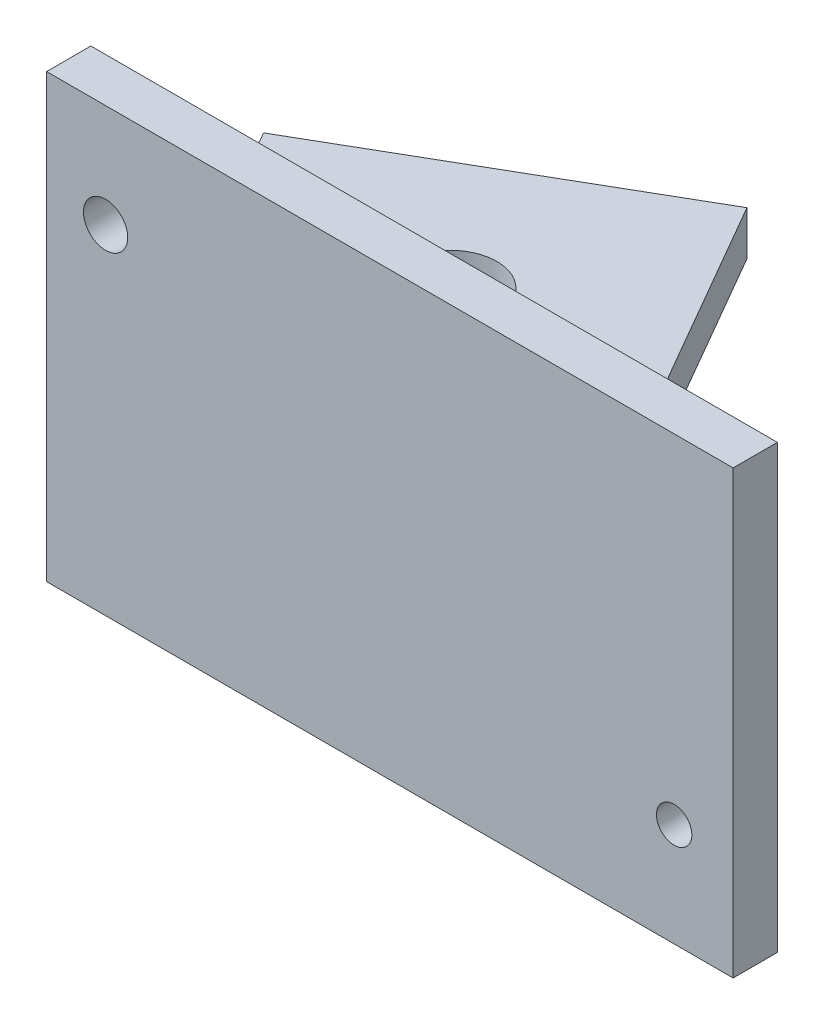
from build123d import *

# Parameters (mm, degrees)
SKETCH1_W           = 36.957
SKETCH1_H           = 21.3995
SKETCH1_R           = 1.190625
SKETCH1_R_2         = 0.9525
BOSS_EXTRUDE1_DEPTH = 2.38125
BOSS_EXTRUDE3_DEPTH = 2.38125
CUT_EXTRUDE2_REACH  = 53.986
SKETCH4_R           = 2.4892


with BuildPart() as part:
    # Sketch1 → Boss-Extrude1 (new body)
    with BuildSketch(Plane.XY):
        with Locations((16.891, 9.11225)):
            Rectangle(SKETCH1_W, SKETCH1_H)
        with Locations((1.5875, 14.25575)):
            Circle(SKETCH1_R, mode=Mode.SUBTRACT)
        with Locations((32.1945, 1.5875)):
            Circle(SKETCH1_R_2, mode=Mode.SUBTRACT)
    extrude(amount=BOSS_EXTRUDE1_DEPTH)

    # Sketch2 → Boss-Extrude3 (add)
    with BuildSketch(Plane.XZ.offset(1.5875)):
        Polygon((-1.5875, 2.38125), (35.3695, 2.38125), (35.3695, 0), (20.409545256, 0), (2.210283942, -31.522045256), (-14.2875, -21.997045256), (-1.5875, 0), align=None)
    extrude(amount=BOSS_EXTRUDE3_DEPTH)

    # Sketch4 → Cut-Extrude2 (cut, up to next)
    with BuildSketch(Plane(origin=(0, -1.5875, 0), x_dir=(1, 0, 0), z_dir=(0, 1, 0)), mode=Mode.PRIVATE) as cut_extrude2_sk1:
        with Locations((-2.018977372, 19.797340731)):
            Circle(SKETCH4_R)
    cut_extrude2_tool1 = extrude(cut_extrude2_sk1.sketch, amount=-CUT_EXTRUDE2_REACH, mode=Mode.PRIVATE) & part.part
    # Sketch4 → Cut-Extrude2 (cut, up to next)
    with BuildSketch(Plane(origin=(0, -1.5875, 0), x_dir=(1, 0, 0), z_dir=(0, 1, 0)), mode=Mode.PRIVATE) as cut_extrude2_sk2:
        with Locations((4.331022628, 8.798818102)):
            Circle(SKETCH4_R)
    cut_extrude2_tool2 = extrude(cut_extrude2_sk2.sketch, amount=-CUT_EXTRUDE2_REACH, mode=Mode.PRIVATE) & part.part
    add(cut_extrude2_tool1.solids().sort_by_distance((-2.018977, -1.5875, -19.797341))[0], mode=Mode.SUBTRACT)
    add(cut_extrude2_tool2.solids().sort_by_distance((4.331023, -1.5875, -8.798818))[0], mode=Mode.SUBTRACT)


solid = part.part
